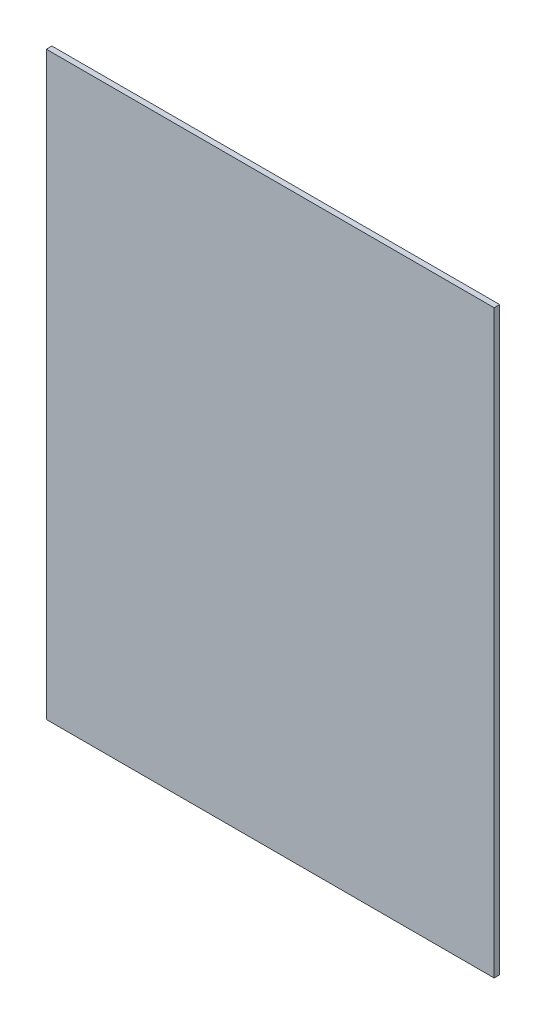
from build123d import *

# Parameters (mm, degrees)
SKETCH1_W           = 162
SKETCH1_H           = 210
BOSS_EXTRUDE1_DEPTH = 2


with BuildPart() as part:
    # Sketch1 → Boss-Extrude1 (new body)
    with BuildSketch(Plane.XY):
        Rectangle(SKETCH1_W, SKETCH1_H)
    extrude(amount=BOSS_EXTRUDE1_DEPTH)


solid = part.part
